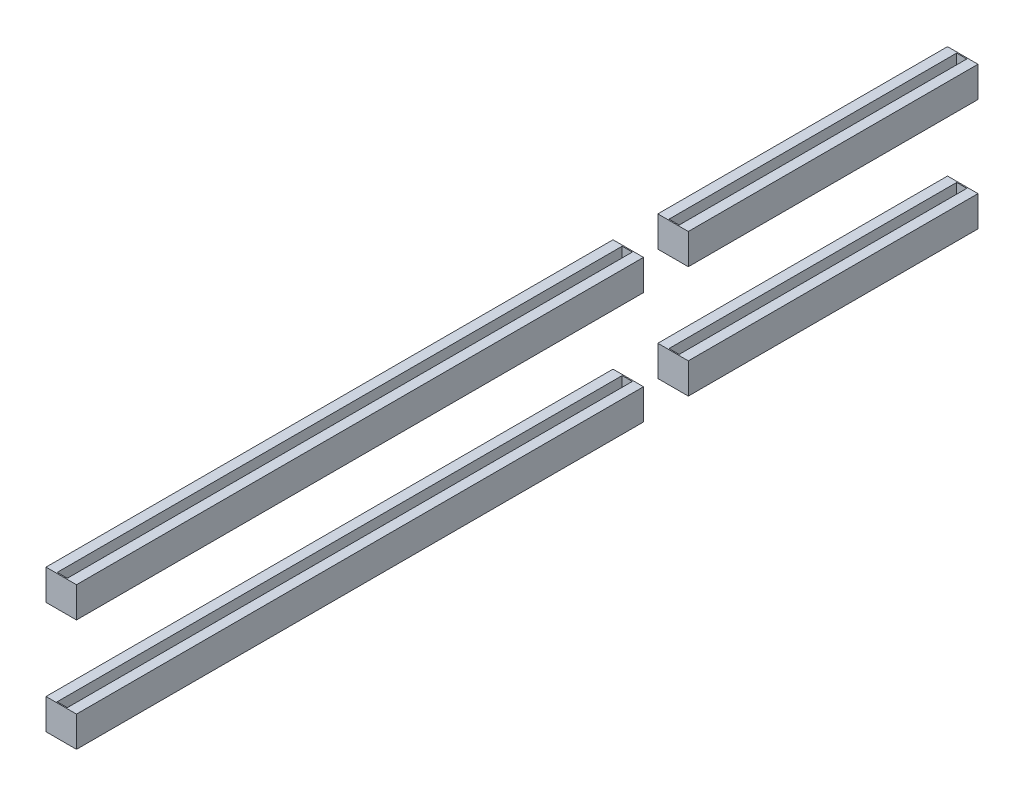
from build123d import *

# Parameters (mm, degrees)
BOSS_EXTRUDE3_DEPTH   = 2248.154
BOSS_EXTRUDE3_2_DEPTH = 2248.154
SKETCH9_W             = 25.4
SKETCH9_H             = 76.2
BOSS_EXTRUDE4_DEPTH   = 2.54
BOSS_EXTRUDE4_2_DEPTH = 2.54
SKETCH11_W            = 25.4
SKETCH11_H            = 76.2
BOSS_EXTRUDE8_DEPTH   = 2.54
SKETCH14_W            = 79.928393775
SKETCH14_H            = 111.76
CUT_EXTRUDE5_DEPTH    = 2332.896918347
SKETCH15_W            = 25.4
SKETCH15_H            = 76.2
BOSS_EXTRUDE9_DEPTH   = 2.54
SKETCH16_W            = 25.4
SKETCH16_H            = 76.2
BOSS_EXTRUDE10_DEPTH  = 2.54


with BuildPart() as part:
    # Sketch1 → Boss-Extrude3 (new body)
    with BuildSketch(Plane.XY):
        Polygon((394.183100921, -272.194404357), (419.4943028, -272.194404357), (419.4943028, -195.994404357), (394.183100921, -195.994404357), (394.183100921, -221.374307502), (368.783100921, -221.374307502), (368.783100921, -195.994404357), (343.471899041, -195.994404357), (343.471899041, -272.194404357), (368.783100921, -272.194404357), (368.783100921, -246.814501211), (394.183100921, -246.814501211), align=None)
    extrude(amount=BOSS_EXTRUDE3_DEPTH)



with BuildPart() as body_2:
    # Sketch1 → Boss-Extrude3 2 (new body)
    with BuildSketch(Plane.XY):
        Polygon((368.783100921, 58.025692498), (368.783100921, 83.405595643), (343.471899041, 83.405595643), (343.471899041, 7.205595643), (368.783100921, 7.205595643), (368.783100921, 32.585498789), (394.183100921, 32.585498789), (394.183100921, 7.205595643), (419.4943028, 7.205595643), (419.4943028, 83.405595643), (394.183100921, 83.405595643), (394.183100921, 58.025692498), align=None)
    extrude(amount=BOSS_EXTRUDE3_2_DEPTH)


with BuildPart() as body_3:
    # Sketch9 → Boss-Extrude4 (new body)
    with BuildSketch(Plane(origin=(0, 0, 0), x_dir=(-1, 0, 0), z_dir=(0, 0, -1))):
        with Locations((-381.483100921, -234.094404357)):
            Rectangle(SKETCH9_W, SKETCH9_H)
    extrude(amount=-BOSS_EXTRUDE4_DEPTH)


with BuildPart() as body_4:
    # Sketch9 → Boss-Extrude4 2 (new body)
    with BuildSketch(Plane(origin=(0, 0, 0), x_dir=(-1, 0, 0), z_dir=(0, 0, -1))):
        with Locations((-381.483100921, 45.305595643)):
            Rectangle(SKETCH9_W, SKETCH9_H)
    extrude(amount=-BOSS_EXTRUDE4_2_DEPTH)


with BuildPart() as part_1:
    add(part.part)

    add(body_2.part)  # Boss-Extrude8 merges body 2
    # Sketch11 → Boss-Extrude8 (add)
    with BuildSketch(Plane.XY.offset(2248.154)):
        with Locations((381.483100921, 45.305595643)):
            Rectangle(SKETCH11_W, SKETCH11_H)
        with Locations((381.483100921, -234.094404357)):
            Rectangle(SKETCH11_W, SKETCH11_H)
    extrude(amount=-BOSS_EXTRUDE8_DEPTH)

    # Sketch14 → Cut-Extrude5 (cut, through all)
    with BuildSketch(Plane(origin=(0, 183.405595643, 0), x_dir=(1, 0, 0), z_dir=(0, 1, 0))):
        with Locations((379.530105913, -778.280771054)):
            Rectangle(SKETCH14_W, SKETCH14_H)
    extrude(amount=-CUT_EXTRUDE5_DEPTH, mode=Mode.SUBTRACT)

    # Sketch15 → Boss-Extrude9 (add)
    with BuildSketch(Plane(origin=(0, 0, 834.160771054), x_dir=(-1, 0, 0), z_dir=(0, 0, -1))):
        with Locations((-381.483100921, -234.094404357)):
            Rectangle(SKETCH15_W, SKETCH15_H)
        with Locations((-381.483100921, 45.305595643)):
            Rectangle(SKETCH15_W, SKETCH15_H)
    extrude(amount=-BOSS_EXTRUDE9_DEPTH)

    # Sketch16 → Boss-Extrude10 (add)
    with BuildSketch(Plane.XY.offset(722.400771054)):
        with Locations((381.483100921, 45.305595643)):
            Rectangle(SKETCH16_W, SKETCH16_H)
        with Locations((381.483100921, -234.094404357)):
            Rectangle(SKETCH16_W, SKETCH16_H)
    extrude(amount=-BOSS_EXTRUDE10_DEPTH)


solid = Compound([body_3.part, body_4.part, part_1.part])
